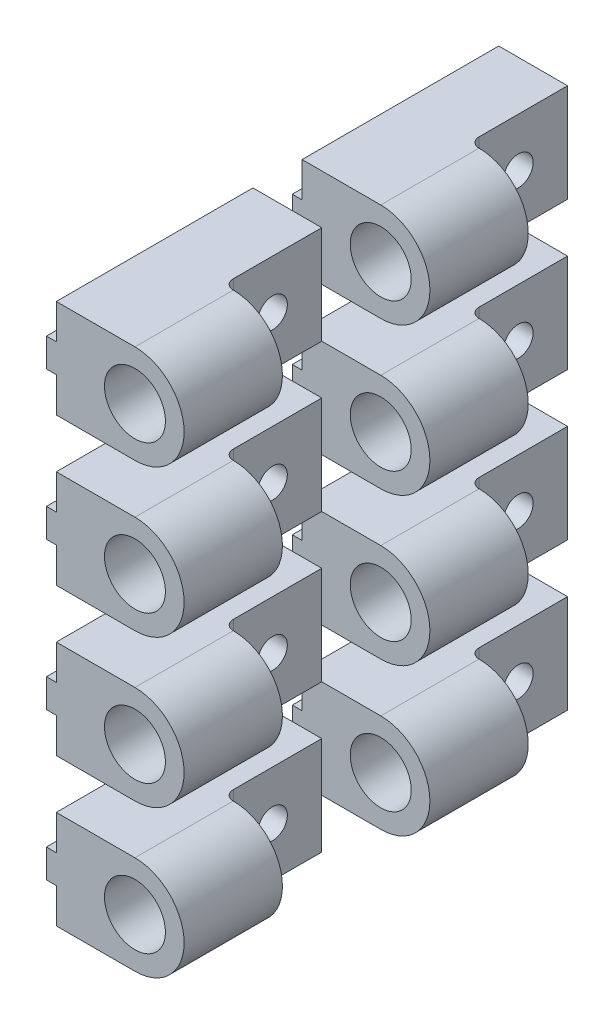
from build123d import *

# Parameters (mm, degrees)
MAIN_DEPTH                     = 20
SKETCH2_R                      = 3.1
SHAFTHOLE_DEPTH                = 5
SKETCH3_W                      = 10
SKETCH3_H                      = 10
MAKERBEAMRECTANGULARHOLE_DEPTH = 23.113344387
SKETCH4_R                      = 1.5
MAKERBEAMHOLE_DEPTH            = 23.113344387
FILLET1_R                      = 1
LPATTERN1_COUNT                = 4
LPATTERN1_PITCH                = 15
LPATTERN1_2_COUNT              = 2
LPATTERN1_2_PITCH              = 25


with BuildPart() as part:
    # Sketch1 → Main (new body)
    with BuildSketch(Plane.XY):
        with BuildLine():
            Line((-8, 5), (-8, 1.45))
            Line((-8, 1.45), (-9, 1.45))
            Line((-9, 1.45), (-9, -1.45))
            Line((-9, -1.45), (-8, -1.45))
            Line((-8, -1.45), (-8, -5))
            Line((-8, -5), (0, -5))
            ThreePointArc((0, -5), (5, 0), (0, 5))
            Line((0, 5), (-8, 5))
        make_face()
    extrude(amount=MAIN_DEPTH)

    # Sketch2 → ShaftHole (cut)
    with BuildSketch(Plane.XY.offset(20)):
        Circle(SKETCH2_R)
    extrude(amount=-SHAFTHOLE_DEPTH, mode=Mode.SUBTRACT)

    # Sketch3 → MakerBeamRectangularHole (cut, through all)
    with BuildSketch(Plane(origin=(-1, 0, 0), x_dir=(0, 0, -1), z_dir=(1, 0, 0))):
        with Locations((-5, 0)):
            Rectangle(SKETCH3_W, SKETCH3_H)
    extrude(amount=MAKERBEAMRECTANGULARHOLE_DEPTH, mode=Mode.SUBTRACT)

    # Sketch4 → MakerBeamHole (cut, through all)
    with BuildSketch(Plane(origin=(-1, 0, 0), x_dir=(0, 0, -1), z_dir=(1, 0, 0))):
        with Locations((-5, 0)):
            Circle(SKETCH4_R)
    extrude(amount=-MAKERBEAMHOLE_DEPTH, mode=Mode.SUBTRACT)

    # Fillet1
    fillet1_edges = [part.edges().sort_by_distance(p)[0] for p in [
        (-1, 0, 10),
    ]]
    fillet(fillet1_edges, radius=FILLET1_R)


with BuildPart() as lpattern1_1:
    # LPattern1: pattern copy
    add(part.part.moved(Location(Vector(0, -1, 0) * (1 * LPATTERN1_PITCH))))


with BuildPart() as lpattern1_2:
    # LPattern1: pattern copy
    add(part.part.moved(Location(Vector(0, -1, 0) * (2 * LPATTERN1_PITCH))))


with BuildPart() as lpattern1_3:
    # LPattern1: pattern copy
    add(part.part.moved(Location(Vector(0, -1, 0) * (3 * LPATTERN1_PITCH))))


with BuildPart() as lpattern1_2_1:
    # LPattern1 2: pattern copy
    add(part.part.moved(Location(Vector(0, 0, 1) * (1 * LPATTERN1_2_PITCH))))


with BuildPart() as lpattern1_2_2:
    # LPattern1 2: pattern copy
    add(lpattern1_1.part.moved(Location(Vector(0, 0, 1) * (1 * LPATTERN1_2_PITCH))))


with BuildPart() as lpattern1_2_3:
    # LPattern1 2: pattern copy
    add(lpattern1_2.part.moved(Location(Vector(0, 0, 1) * (1 * LPATTERN1_2_PITCH))))


with BuildPart() as lpattern1_2_4:
    # LPattern1 2: pattern copy
    add(lpattern1_3.part.moved(Location(Vector(0, 0, 1) * (1 * LPATTERN1_2_PITCH))))


solid = Compound([part.part, lpattern1_1.part, lpattern1_2.part, lpattern1_3.part, lpattern1_2_1.part, lpattern1_2_2.part, lpattern1_2_3.part, lpattern1_2_4.part])
